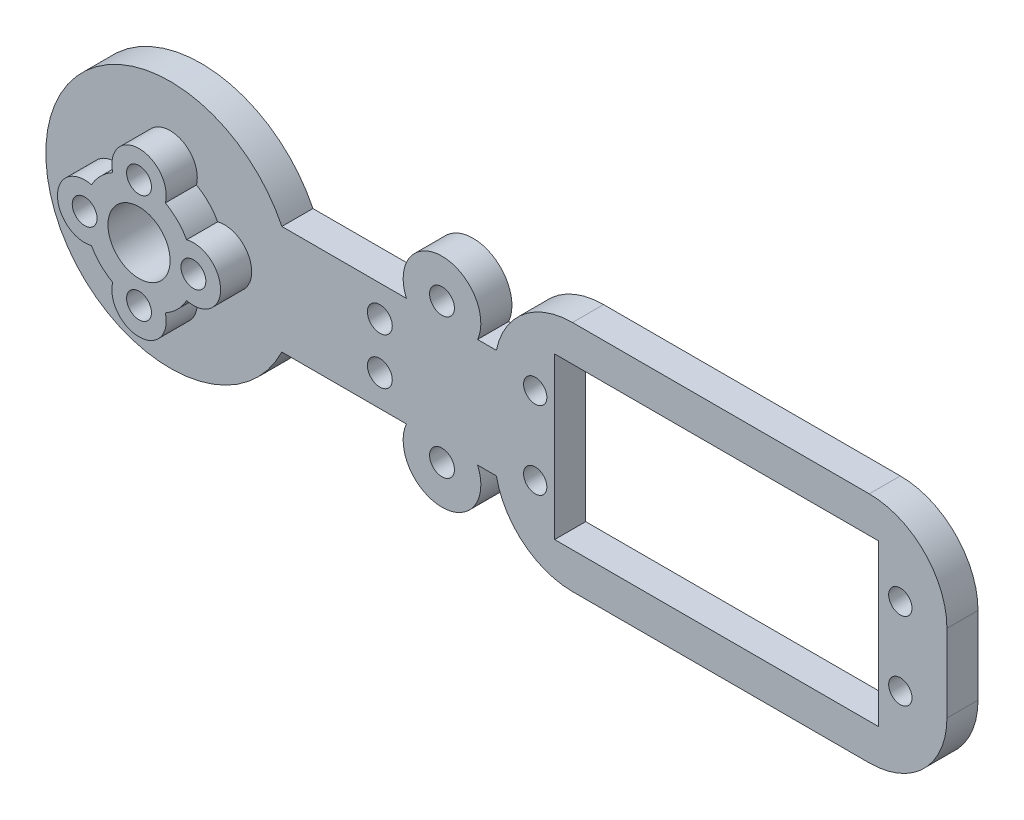
from build123d import *

# Parameters (mm, degrees)
MAIN_WEB_PROFILE_W                             = 60
MAIN_WEB_PROFILE_H                             = 14
MAIN_WEB_DEPTH                                 = 4
SHOULDER_HORN_FLANGE_PROFILE_R                 = 16
SHOULDER_HORN_FLANGE_DEPTH                     = 4
ELBOW_SERVO_MOUNT_PROFILE_W                    = 48
ELBOW_SERVO_MOUNT_PROFILE_H                    = 28
ELBOW_SERVO_MOUNT_DEPTH                        = 4
SG90_BODY_CLEARANCE_START                      = -5
SG90_BODY_CLEARANCE_PROFILE_W                  = 23.8
SG90_BODY_CLEARANCE_PROFILE_H                  = 13
SG90_BODY_CLEARANCE_DEPTH                      = 97.49863387
ELBOW_TAB_FASTENERS_START                      = -50
ELBOW_TAB_FASTENERS_PROFILE_R                  = 1.3
ELBOW_TAB_FASTENERS_DEPTH                      = 142.49863387
SHOULDER_CENTER_SCREW_ACCESS_START             = -50
SHOULDER_CENTER_SCREW_ACCESS_PROFILE_R         = 4
SHOULDER_CENTER_SCREW_ACCESS_DEPTH             = 142.49863387
CABLE_TIE_HOLES_START                          = -50
CABLE_TIE_HOLES_PROFILE_R                      = 1.6
CABLE_TIE_HOLES_DEPTH                          = 142.49863387
PASSIVE_LOWER_MOUNT_BOSS_PROFILE_R             = 5
PASSIVE_LOWER_MOUNT_BOSS_DEPTH                 = 4
PASSIVE_UPPER_MOUNT_BOSS_PROFILE_R             = 5
PASSIVE_UPPER_MOUNT_BOSS_DEPTH                 = 4
PASSIVE_CHEEK_STANDOFFS_START                  = -50
PASSIVE_CHEEK_STANDOFFS_PROFILE_R              = 1.6
PASSIVE_CHEEK_STANDOFFS_DEPTH                  = 142.49863387
SHOULDER_DOWEL_SUPPORT_HUB_START               = 4
SHOULDER_DOWEL_SUPPORT_HUB_PROFILE_R           = 7
SHOULDER_DOWEL_SUPPORT_HUB_PROFILE_R_2         = 4
SHOULDER_DOWEL_SUPPORT_HUB_DEPTH               = 4
RAISED_M3_WASHER_SEATS_HEIGHT8_START           = 4
RAISED_M3_WASHER_SEATS_PCD14_PROFILE_R         = 3.5
RAISED_M3_WASHER_SEATS_HEIGHT8_DEPTH           = 4
METAL_HORN_M3_CLEARANCE_PCD14_START            = -50
METAL_HORN_M3_CLEARANCE_PCD14_PROFILE_R        = 1.6
METAL_HORN_M3_CLEARANCE_PCD14_DEPTH            = 142.760557976
RESTORE_SHOULDER_SLEEVE_BORE_START             = -50
RESTORE_SHOULDER_SLEEVE_BORE_PROFILE_R         = 4
RESTORE_SHOULDER_SLEEVE_BORE_DEPTH             = 142.760557976
FILLET1_R                                      = 7.5
LARGER_ELBOW_SERVO_MOUNT_REPLACES_SG_2_W       = 58
LARGER_ELBOW_SERVO_MOUNT_REPLACES_SG_2_H       = 30
LARGER_ELBOW_SERVO_MOUNT_REPLACES_SG90_O_DEPTH = 4
MG996R_ELBOW_BODY_CLEARANCE_START              = -5
MG996R_ELBOW_BODY_CLEARANCE_PROFILE_W          = 41.7
MG996R_ELBOW_BODY_CLEARANCE_PROFILE_H          = 20.7
MG996R_ELBOW_BODY_CLEARANCE_DEPTH              = 107.587400794
MG996R_ELBOW_TAB_FASTENERS_START               = -50
MG996R_ELBOW_TAB_FASTENERS_PROFILE_R           = 1.5
MG996R_ELBOW_TAB_FASTENERS_DEPTH               = 152.587400794
FILLET2_R                                      = 10


with BuildPart() as part:
    # Main_web_profile → Main_web (new body)
    with BuildSketch(Plane.XY):
        with Locations((30, 0)):
            Rectangle(MAIN_WEB_PROFILE_W, MAIN_WEB_PROFILE_H)
    extrude(amount=MAIN_WEB_DEPTH)

    # Shoulder_horn_flange_profile → Shoulder_horn_flange (add)
    with BuildSketch(Plane.XY):
        Circle(SHOULDER_HORN_FLANGE_PROFILE_R)
    extrude(amount=SHOULDER_HORN_FLANGE_DEPTH)

    # Elbow_servo_mount_profile → Elbow_servo_mount (add)
    with BuildSketch(Plane.XY):
        with Locations((66, 0)):
            Rectangle(ELBOW_SERVO_MOUNT_PROFILE_W, ELBOW_SERVO_MOUNT_PROFILE_H)
    extrude(amount=ELBOW_SERVO_MOUNT_DEPTH)

    # SG90_body_clearance_profile → SG90_body_clearance (cut, through all)
    with BuildSketch(Plane.XY.offset(SG90_BODY_CLEARANCE_START)):
        with Locations((65.5, 0)):
            Rectangle(SG90_BODY_CLEARANCE_PROFILE_W, SG90_BODY_CLEARANCE_PROFILE_H)
    extrude(amount=SG90_BODY_CLEARANCE_DEPTH, mode=Mode.SUBTRACT)

    # Elbow_tab_fasteners_profile → Elbow_tab_fasteners (cut, through all)
    with BuildSketch(Plane.XY.offset(ELBOW_TAB_FASTENERS_START)):
        with Locations(Location((51, 0, 0), (0, 0, 180))):
            Circle(ELBOW_TAB_FASTENERS_PROFILE_R)
        with Locations(Location((80, 0, 0), (0, 0, 180))):
            Circle(ELBOW_TAB_FASTENERS_PROFILE_R)
    extrude(amount=ELBOW_TAB_FASTENERS_DEPTH, mode=Mode.SUBTRACT)

    # Shoulder_center_screw_access_profile → Shoulder_center_screw_access (cut, through all)
    with BuildSketch(Plane.XY.offset(SHOULDER_CENTER_SCREW_ACCESS_START)):
        with Locations(Location((0, 0, 0), (0, 0, 180))):
            Circle(SHOULDER_CENTER_SCREW_ACCESS_PROFILE_R)
    extrude(amount=SHOULDER_CENTER_SCREW_ACCESS_DEPTH, mode=Mode.SUBTRACT)

    # Cable_tie_holes_profile → Cable_tie_holes (cut, through all)
    with BuildSketch(Plane.XY.offset(CABLE_TIE_HOLES_START)):
        with Locations(Location((27, -3, 0), (0, 0, 180))):
            Circle(CABLE_TIE_HOLES_PROFILE_R)
        with Locations(Location((27, 3, 0), (0, 0, 180))):
            Circle(CABLE_TIE_HOLES_PROFILE_R)
    extrude(amount=CABLE_TIE_HOLES_DEPTH, mode=Mode.SUBTRACT)

    # Passive_lower_mount_boss_profile → Passive_lower_mount_boss (add)
    with BuildSketch(Plane.XY):
        with Locations((35, -9)):
            Circle(PASSIVE_LOWER_MOUNT_BOSS_PROFILE_R)
    extrude(amount=PASSIVE_LOWER_MOUNT_BOSS_DEPTH)

    # Passive_upper_mount_boss_profile → Passive_upper_mount_boss (add)
    with BuildSketch(Plane.XY):
        with Locations((35, 9)):
            Circle(PASSIVE_UPPER_MOUNT_BOSS_PROFILE_R)
    extrude(amount=PASSIVE_UPPER_MOUNT_BOSS_DEPTH)

    # Passive_cheek_standoffs_profile → Passive_cheek_standoffs (cut, through all)
    with BuildSketch(Plane.XY.offset(PASSIVE_CHEEK_STANDOFFS_START)):
        with Locations(Location((35, -9, 0), (0, 0, 180))):
            Circle(PASSIVE_CHEEK_STANDOFFS_PROFILE_R)
        with Locations(Location((35, 9, 0), (0, 0, 180))):
            Circle(PASSIVE_CHEEK_STANDOFFS_PROFILE_R)
    extrude(amount=PASSIVE_CHEEK_STANDOFFS_DEPTH, mode=Mode.SUBTRACT)

    # Shoulder_dowel_support_hub_profile → Shoulder_dowel_support_hub (add)
    with BuildSketch(Plane.XY.offset(SHOULDER_DOWEL_SUPPORT_HUB_START)):
        Circle(SHOULDER_DOWEL_SUPPORT_HUB_PROFILE_R)
        with Locations(Location((0, 0, 0), (0, 0, 180))):
            Circle(SHOULDER_DOWEL_SUPPORT_HUB_PROFILE_R_2, mode=Mode.SUBTRACT)
    extrude(amount=SHOULDER_DOWEL_SUPPORT_HUB_DEPTH)

    # Raised_M3_washer_seats_PCD14_profile → Raised_M3_washer_seats_height8 (add)
    with BuildSketch(Plane.XY.offset(RAISED_M3_WASHER_SEATS_HEIGHT8_START)):
        with Locations((7, 0)):
            Circle(RAISED_M3_WASHER_SEATS_PCD14_PROFILE_R)
        with Locations((-7, 0)):
            Circle(RAISED_M3_WASHER_SEATS_PCD14_PROFILE_R)
        with Locations((0, 7)):
            Circle(RAISED_M3_WASHER_SEATS_PCD14_PROFILE_R)
        with Locations((0, -7)):
            Circle(RAISED_M3_WASHER_SEATS_PCD14_PROFILE_R)
    extrude(amount=RAISED_M3_WASHER_SEATS_HEIGHT8_DEPTH)

    # Metal_horn_M3_clearance_PCD14_profile → Metal_horn_M3_clearance_PCD14 (cut, through all)
    with BuildSketch(Plane.XY.offset(METAL_HORN_M3_CLEARANCE_PCD14_START)):
        with Locations(Location((7, 0, 0), (0, 0, 180))):
            Circle(METAL_HORN_M3_CLEARANCE_PCD14_PROFILE_R)
        with Locations(Location((-7, 0, 0), (0, 0, 180))):
            Circle(METAL_HORN_M3_CLEARANCE_PCD14_PROFILE_R)
        with Locations(Location((0, 7, 0), (0, 0, 180))):
            Circle(METAL_HORN_M3_CLEARANCE_PCD14_PROFILE_R)
        with Locations(Location((0, -7, 0), (0, 0, 180))):
            Circle(METAL_HORN_M3_CLEARANCE_PCD14_PROFILE_R)
    extrude(amount=METAL_HORN_M3_CLEARANCE_PCD14_DEPTH, mode=Mode.SUBTRACT)

    # Restore_shoulder_sleeve_bore_profile → Restore_shoulder_sleeve_bore (cut, through all)
    with BuildSketch(Plane.XY.offset(RESTORE_SHOULDER_SLEEVE_BORE_START)):
        with Locations(Location((0, 0, 0), (0, 0, 180))):
            Circle(RESTORE_SHOULDER_SLEEVE_BORE_PROFILE_R)
    extrude(amount=RESTORE_SHOULDER_SLEEVE_BORE_DEPTH, mode=Mode.SUBTRACT)

    # Fillet1
    # the kernel refuses this fillet: 7.5 mm, written as the material it takes off along each edge
    with BuildSketch(Plane(origin=(42, -14, -18.708286934), x_dir=(0, 1, 0), z_dir=(0, 0, 1))) as fillet1_piece_1:
        with BuildLine():
            CenterArc((7.5, -7.483314774), FILLET1_R, 93.822553729, 86.177446271)
            Line((0, -7.483314774), (-0.15, -7.483314774))
            Line((-0.15, -7.483314774), (-0.15, 0))
            Line((-0.15, 0), (0, 0.15))
            ThreePointArc((0, 0.15), (3.5, 0.15), (6.99, 0.149666295))
            Line((6.99, 0.149666295), (7, 0))
        make_face()
    extrude(amount=41.416573868, mode=Mode.SUBTRACT)
    with BuildSketch(Plane(origin=(90, -14, -18.75), x_dir=(-1, 0, 0), z_dir=(0, 0, 1)), Plane(origin=(90, 14, -18.75), x_dir=(0, -1, 0), z_dir=(0, 0, 1))) as fillet1_piece_2:
        with BuildLine():
            CenterArc((FILLET1_R, -FILLET1_R), FILLET1_R, 90, 90)
            Line((0, -FILLET1_R), (-FILLET1_R * 0.02, -FILLET1_R))
            Line((-FILLET1_R * 0.02, -FILLET1_R), (-FILLET1_R * 0.02, FILLET1_R * 0.02))
            Line((-FILLET1_R * 0.02, FILLET1_R * 0.02), (FILLET1_R, FILLET1_R * 0.02))
            Line((FILLET1_R, FILLET1_R * 0.02), (FILLET1_R, 0))
        make_face()
    extrude(amount=41.5, mode=Mode.SUBTRACT)
    with BuildSketch(Plane(origin=(42, 14, -18.708286934), x_dir=(0, -1, 0), z_dir=(0, 0, 1))) as fillet1_piece_3:
        with BuildLine():
            CenterArc((7.5, 7.483314774), FILLET1_R, 180, 86.177446271)
            Line((0, 7.483314774), (-0.15, 7.483314774))
            Line((-0.15, 7.483314774), (-0.15, 0))
            Line((-0.15, 0), (0, -0.15))
            ThreePointArc((0, -0.15), (3.5, -0.15), (6.99, -0.149666295))
            Line((6.99, -0.149666295), (7, 0))
        make_face()
    extrude(amount=41.416573868, mode=Mode.SUBTRACT)

    # Larger_elbow_servo_mount_replaces_SG 2 → Larger_elbow_servo_mount_replaces_SG90_o (add)
    with BuildSketch(Plane.XY):
        with Locations((71, 0)):
            Rectangle(LARGER_ELBOW_SERVO_MOUNT_REPLACES_SG_2_W, LARGER_ELBOW_SERVO_MOUNT_REPLACES_SG_2_H)
    extrude(amount=LARGER_ELBOW_SERVO_MOUNT_REPLACES_SG90_O_DEPTH)

    # MG996R_elbow_body_clearance_profile → MG996R_elbow_body_clearance (cut, through all)
    with BuildSketch(Plane.XY.offset(MG996R_ELBOW_BODY_CLEARANCE_START)):
        with Locations((70.35, 0)):
            Rectangle(MG996R_ELBOW_BODY_CLEARANCE_PROFILE_W, MG996R_ELBOW_BODY_CLEARANCE_PROFILE_H)
    extrude(amount=MG996R_ELBOW_BODY_CLEARANCE_DEPTH, mode=Mode.SUBTRACT)

    # MG996R_elbow_tab_fasteners_profile → MG996R_elbow_tab_fasteners (cut, through all)
    with BuildSketch(Plane.XY.offset(MG996R_ELBOW_TAB_FASTENERS_START)):
        with Locations(Location((47, -5, 0), (0, 0, 180))):
            Circle(MG996R_ELBOW_TAB_FASTENERS_PROFILE_R)
        with Locations(Location((47, 5, 0), (0, 0, 180))):
            Circle(MG996R_ELBOW_TAB_FASTENERS_PROFILE_R)
        with Locations(Location((94, -5, 0), (0, 0, 180))):
            Circle(MG996R_ELBOW_TAB_FASTENERS_PROFILE_R)
        with Locations(Location((94, 5, 0), (0, 0, 180))):
            Circle(MG996R_ELBOW_TAB_FASTENERS_PROFILE_R)
    extrude(amount=MG996R_ELBOW_TAB_FASTENERS_DEPTH, mode=Mode.SUBTRACT)

    # Fillet2
    # the kernel refuses this fillet: 10 mm, written as the material it takes off along each edge
    with BuildSketch(Plane(origin=(42, 15, -24.494897428), x_dir=(1, 0, 0), z_dir=(0, 0, 1))) as fillet2_piece_1:
        with BuildLine():
            CenterArc((9.797958971, -10), FILLET2_R, 90, 78.463040967)
            Line((0, -8), (-0.195959179, -7.96))
            ThreePointArc((-0.195959179, -7.96), (-0.2, -4), (-0.2, 0))
            Line((-0.2, 0), (0, 0.2))
            Line((0, 0.2), (9.797958971, 0.2))
            Line((9.797958971, 0.2), (9.797958971, 0))
        make_face()
    extrude(amount=52.989794856, mode=Mode.SUBTRACT)
    with BuildSketch(Plane(origin=(42, -15, -24.494897428), x_dir=(0, 1, 0), z_dir=(0, 0, 1))) as fillet2_piece_2:
        with BuildLine():
            CenterArc((10, -9.797958971), FILLET2_R, 101.536959033, 78.463040967)
            Line((0, -9.797958971), (-0.2, -9.797958971))
            Line((-0.2, -9.797958971), (-0.2, 0))
            Line((-0.2, 0), (0, 0.2))
            ThreePointArc((0, 0.2), (4, 0.2), (7.96, 0.195959179))
            Line((7.96, 0.195959179), (8, 0))
        make_face()
    extrude(amount=52.989794856, mode=Mode.SUBTRACT)
    with BuildSketch(Plane(origin=(100, -15, -25), x_dir=(-1, 0, 0), z_dir=(0, 0, 1)), Plane(origin=(100, 15, -25), x_dir=(0, -1, 0), z_dir=(0, 0, 1))) as fillet2_piece_3:
        with BuildLine():
            CenterArc((FILLET2_R, -FILLET2_R), FILLET2_R, 90, 90)
            Line((0, -FILLET2_R), (-FILLET2_R * 0.02, -FILLET2_R))
            Line((-FILLET2_R * 0.02, -FILLET2_R), (-FILLET2_R * 0.02, FILLET2_R * 0.02))
            Line((-FILLET2_R * 0.02, FILLET2_R * 0.02), (FILLET2_R, FILLET2_R * 0.02))
            Line((FILLET2_R, FILLET2_R * 0.02), (FILLET2_R, 0))
        make_face()
    extrude(amount=54, mode=Mode.SUBTRACT)


solid = part.part
